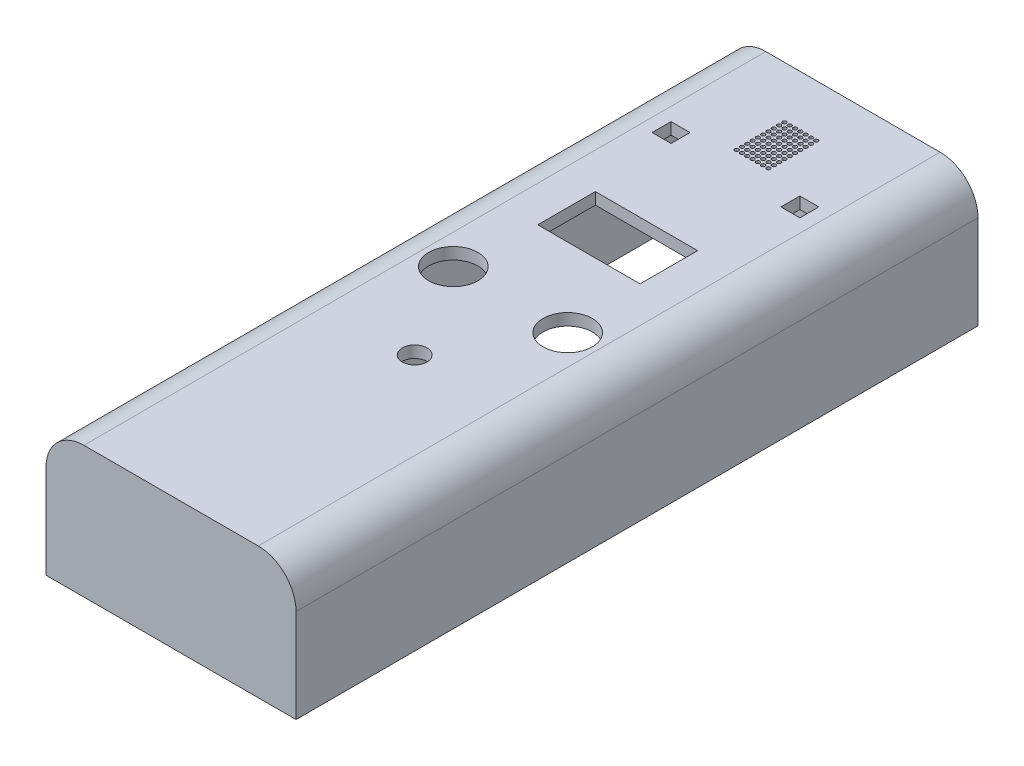
from build123d import *

# Parameters (mm, degrees)
SKETCH1_W           = 66
SKETCH1_H           = 180
BOSS_EXTRUDE1_DEPTH = 34.7
FILLET1_R           = 10
SHELL1_T            = -3.1
SKETCH4_R           = 6.5
CUT_EXTRUDE4_DEPTH  = 195.833493014
SKETCH2_R           = 3.25
CUT_EXTRUDE5_DEPTH  = 195.833493014
SKETCH5_W           = 27
SKETCH5_H           = 15.2
CUT_EXTRUDE6_DEPTH  = 195.833493014
SKETCH6_W           = 5
SKETCH6_H           = 5
CUT_EXTRUDE10_DEPTH = 195.833493014
SKETCH31_R          = 0.5
CUT_EXTRUDE11_DEPTH = 195.833493014


with BuildPart() as part:
    # Sketch1 → Boss-Extrude1 (new body)
    with BuildSketch(Plane(origin=(0, 0, 0), x_dir=(1, 0, 0), z_dir=(0, 1, 0))):
        with Locations((33, 90)):
            Rectangle(SKETCH1_W, SKETCH1_H)
    extrude(amount=BOSS_EXTRUDE1_DEPTH)

    # Fillet1
    fillet1_edges = [part.edges().sort_by_distance(p)[0] for p in [
        (66, 34.7, -90),
        (0, 34.7, -90),
    ]]
    fillet(fillet1_edges, radius=FILLET1_R)

    # Shell1
    shell1_openings = [part.faces().sort_by_distance(p)[0] for p in [
        (33, 0, -90),
    ]]
    offset(amount=SHELL1_T, openings=shell1_openings, kind=Kind.INTERSECTION)

    # Sketch4 → Cut-Extrude4 (cut, through all)
    with BuildSketch(Plane(origin=(0, 34.7, 0), x_dir=(1, 0, 0), z_dir=(0, 1, 0))):
        with Locations((48.1, 89.6)):
            Circle(SKETCH4_R)
        with Locations((17.9, 89.6)):
            Circle(SKETCH4_R)
    extrude(amount=-CUT_EXTRUDE4_DEPTH, mode=Mode.SUBTRACT)

    # Sketch2 → Cut-Extrude5 (cut, through all)
    with BuildSketch(Plane(origin=(0, 34.7, 0), x_dir=(1, 0, 0), z_dir=(0, 1, 0))):
        with Locations((33, 64.3)):
            Circle(SKETCH2_R)
    extrude(amount=-CUT_EXTRUDE5_DEPTH, mode=Mode.SUBTRACT)

    # Sketch5 → Cut-Extrude6 (cut, through all)
    with BuildSketch(Plane(origin=(0, 34.7, 0), x_dir=(1, 0, 0), z_dir=(0, 1, 0))):
        with Locations((33, 117.9)):
            Rectangle(SKETCH5_W, SKETCH5_H)
    extrude(amount=-CUT_EXTRUDE6_DEPTH, mode=Mode.SUBTRACT)

    # Sketch6 → Cut-Extrude10 (cut, through all)
    with BuildSketch(Plane(origin=(0, 34.7, 0), x_dir=(1, 0, 0), z_dir=(0, 1, 0))):
        with Locations((50, 148.979436507)):
            Rectangle(SKETCH6_W, SKETCH6_H)
        with Locations((16, 148.979436507)):
            Rectangle(SKETCH6_W, SKETCH6_H)
    extrude(amount=-CUT_EXTRUDE10_DEPTH, mode=Mode.SUBTRACT)

    # Sketch31 → Cut-Extrude11 (cut, through all)
    with BuildSketch(Plane(origin=(0, 34.7, 0), x_dir=(1, 0, 0), z_dir=(0, 1, 0))):
        with Locations((28.628571429, 166.273512362)):
            Circle(SKETCH31_R)
        with Locations((30.028571429, 166.273512362)):
            Circle(SKETCH31_R)
        with Locations((31.428571429, 166.273512362)):
            Circle(SKETCH31_R)
        with Locations((32.828571429, 166.273512362)):
            Circle(SKETCH31_R)
        with Locations((34.228571429, 166.273512362)):
            Circle(SKETCH31_R)
        with Locations((35.628571429, 166.273512362)):
            Circle(SKETCH31_R)
        with Locations((37.028571429, 166.273512362)):
            Circle(SKETCH31_R)
        with Locations((30.028571429, 164.873512362)):
            Circle(SKETCH31_R)
        with Locations((31.428571429, 164.873512362)):
            Circle(SKETCH31_R)
        with Locations((32.828571429, 164.873512362)):
            Circle(SKETCH31_R)
        with Locations((34.228571429, 164.873512362)):
            Circle(SKETCH31_R)
        with Locations((35.628571429, 164.873512362)):
            Circle(SKETCH31_R)
        with Locations((37.028571429, 164.873512362)):
            Circle(SKETCH31_R)
        with Locations((30.028571429, 163.473512362)):
            Circle(SKETCH31_R)
        with Locations((31.428571429, 163.473512362)):
            Circle(SKETCH31_R)
        with Locations((32.828571429, 163.473512362)):
            Circle(SKETCH31_R)
        with Locations((34.228571429, 163.473512362)):
            Circle(SKETCH31_R)
        with Locations((35.628571429, 163.473512362)):
            Circle(SKETCH31_R)
        with Locations((37.028571429, 163.473512362)):
            Circle(SKETCH31_R)
        with Locations((30.028571429, 162.073512362)):
            Circle(SKETCH31_R)
        with Locations((31.428571429, 162.073512362)):
            Circle(SKETCH31_R)
        with Locations((32.828571429, 162.073512362)):
            Circle(SKETCH31_R)
        with Locations((34.228571429, 162.073512362)):
            Circle(SKETCH31_R)
        with Locations((35.628571429, 162.073512362)):
            Circle(SKETCH31_R)
        with Locations((37.028571429, 162.073512362)):
            Circle(SKETCH31_R)
        with Locations((30.028571429, 160.673512362)):
            Circle(SKETCH31_R)
        with Locations((31.428571429, 160.673512362)):
            Circle(SKETCH31_R)
        with Locations((32.828571429, 160.673512362)):
            Circle(SKETCH31_R)
        with Locations((34.228571429, 160.673512362)):
            Circle(SKETCH31_R)
        with Locations((35.628571429, 160.673512362)):
            Circle(SKETCH31_R)
        with Locations((37.028571429, 160.673512362)):
            Circle(SKETCH31_R)
        with Locations((30.028571429, 159.273512362)):
            Circle(SKETCH31_R)
        with Locations((31.428571429, 159.273512362)):
            Circle(SKETCH31_R)
        with Locations((32.828571429, 159.273512362)):
            Circle(SKETCH31_R)
        with Locations((34.228571429, 159.273512362)):
            Circle(SKETCH31_R)
        with Locations((35.628571429, 159.273512362)):
            Circle(SKETCH31_R)
        with Locations((37.028571429, 159.273512362)):
            Circle(SKETCH31_R)
        with Locations((30.028571429, 157.873512362)):
            Circle(SKETCH31_R)
        with Locations((31.428571429, 157.873512362)):
            Circle(SKETCH31_R)
        with Locations((32.828571429, 157.873512362)):
            Circle(SKETCH31_R)
        with Locations((34.228571429, 157.873512362)):
            Circle(SKETCH31_R)
        with Locations((35.628571429, 157.873512362)):
            Circle(SKETCH31_R)
        with Locations((37.028571429, 157.873512362)):
            Circle(SKETCH31_R)
        with Locations((30.028571429, 156.473512362)):
            Circle(SKETCH31_R)
        with Locations((31.428571429, 156.473512362)):
            Circle(SKETCH31_R)
        with Locations((32.828571429, 156.473512362)):
            Circle(SKETCH31_R)
        with Locations((34.228571429, 156.473512362)):
            Circle(SKETCH31_R)
        with Locations((35.628571429, 156.473512362)):
            Circle(SKETCH31_R)
        with Locations((37.028571429, 156.473512362)):
            Circle(SKETCH31_R)
        with Locations((30.028571429, 155.073512362)):
            Circle(SKETCH31_R)
        with Locations((31.428571429, 155.073512362)):
            Circle(SKETCH31_R)
        with Locations((32.828571429, 155.073512362)):
            Circle(SKETCH31_R)
        with Locations((34.228571429, 155.073512362)):
            Circle(SKETCH31_R)
        with Locations((35.628571429, 155.073512362)):
            Circle(SKETCH31_R)
        with Locations((37.028571429, 155.073512362)):
            Circle(SKETCH31_R)
        with Locations((30.028571429, 153.673512362)):
            Circle(SKETCH31_R)
        with Locations((31.428571429, 153.673512362)):
            Circle(SKETCH31_R)
        with Locations((32.828571429, 153.673512362)):
            Circle(SKETCH31_R)
        with Locations((34.228571429, 153.673512362)):
            Circle(SKETCH31_R)
        with Locations((35.628571429, 153.673512362)):
            Circle(SKETCH31_R)
        with Locations((37.028571429, 153.673512362)):
            Circle(SKETCH31_R)
        with Locations((28.628571429, 164.873512362)):
            Circle(SKETCH31_R)
        with Locations((28.628571429, 163.473512362)):
            Circle(SKETCH31_R)
        with Locations((28.628571429, 162.073512362)):
            Circle(SKETCH31_R)
        with Locations((28.628571429, 160.673512362)):
            Circle(SKETCH31_R)
        with Locations((28.628571429, 159.273512362)):
            Circle(SKETCH31_R)
        with Locations((28.628571429, 157.873512362)):
            Circle(SKETCH31_R)
        with Locations((28.628571429, 156.473512362)):
            Circle(SKETCH31_R)
        with Locations((28.628571429, 155.073512362)):
            Circle(SKETCH31_R)
        with Locations((28.628571429, 153.673512362)):
            Circle(SKETCH31_R)
    extrude(amount=-CUT_EXTRUDE11_DEPTH, mode=Mode.SUBTRACT)


solid = part.part
